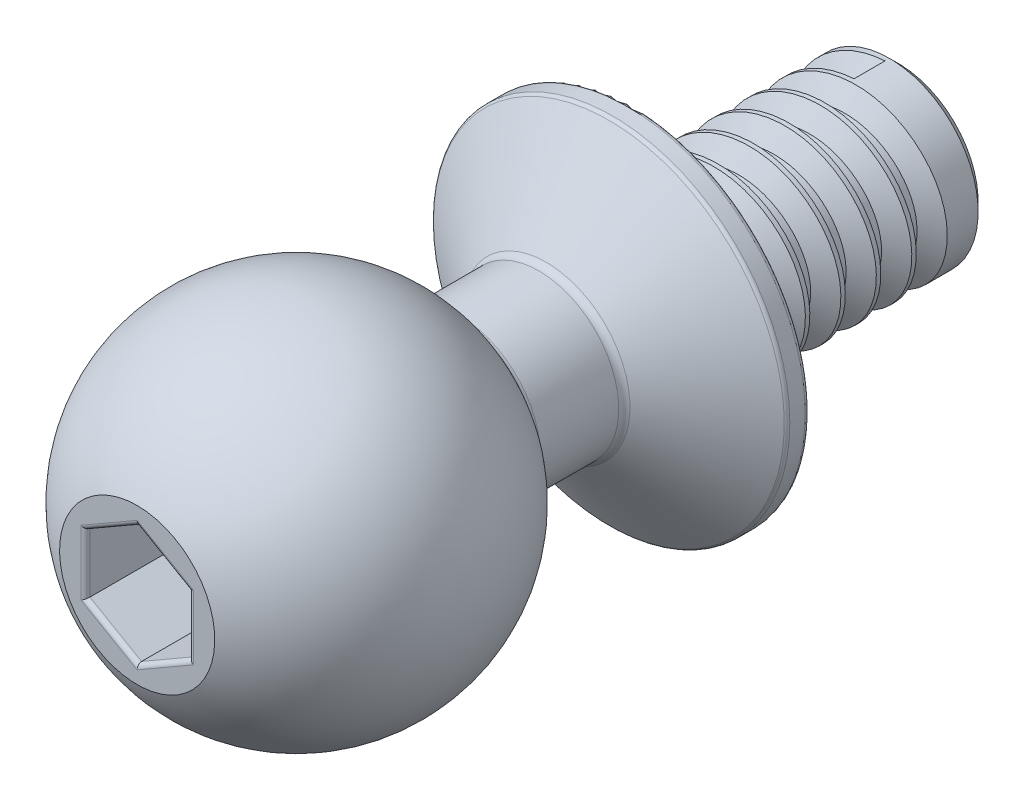
from build123d import *

# Parameters (mm, degrees)
CHAMFER1_SIZE      = 0.1
THREAD1_PITCH      = 0.4
FILLET1_R          = 0.05
FILLET2_R          = 0.1
CUT_EXTRUDE1_DEPTH = 1
FILLET3_R          = 0.05


with BuildPart() as part:
    # Sketch2 → Revolve1 (revolve)
    with BuildSketch(Plane(origin=(0, 0, 0), x_dir=(0, 0, -1), z_dir=(1, 0, 0)), mode=Mode.PRIVATE) as revolve1_sk:
        with BuildLine():
            Line((0, 0), (0, 1))
            Line((0, 1), (-3, 1))
            Line((-3, 1), (-3, 2))
            Line((-3, 2), (-3.25, 2))
            Line((-3.25, 2), (-4, 0.9))
            Line((-4, 0.9), (-5, 0.9))
            ThreePointArc((-5, 0.9), (-6.800005741, 1.999951358), (-8.584493931, 0.875))
            Line((-8.584493931, 0.875), (-8.584493931, 0))
            Line((-8.584493931, 0), (0, 0))
        make_face()
    revolve(revolve1_sk.sketch.rotate(Axis((0, 0, 0), (0, 0, 1)), 90), axis=Axis((0, 0, 0), (0, 0, 1)))

    # Chamfer1
    chamfer1_edges = [part.edges().sort_by_distance(p)[0] for p in [
        (1, 0, 0),
    ]]
    chamfer(chamfer1_edges, length=CHAMFER1_SIZE)

    # Thread1: the profile of Thread Profile1 profile screwed along a right-hand helix of 6.25 turns, 6 arcs to a turn; built about Z, then put on its axis
    thread1_z = Axis((0, 0, 0), (0, 0, 1))
    thread1_corners = [(1.0003, 0, -0.000173205), (1.0003, 0, 0.350173204), (0.78349365, 0, 0.224999999), (0.78349365, 0, 0.124999999)]
    with BuildLine(mode=Mode.PRIVATE) as thread1_profile:
        Line(thread1_corners[0], thread1_corners[1])
        Line(thread1_corners[1], thread1_corners[2])
        Line(thread1_corners[2], thread1_corners[3])
        Line(thread1_corners[3], thread1_corners[0])
    thread1_cap = Face(thread1_profile.wire())
    thread1_turn_angles = [0, 30, 60, 90, 120, 150, 180, 210, 240, 270, 300, 330, 360]
    thread1_turn_weights = [1, 0.8660254037844387, 1, 0.8660254037844387, 1, 0.8660254037844387, 1, 0.8660254037844387, 1, 0.8660254037844387, 1, 0.8660254037844387, 1]
    thread1_turn_rails = [Edge.make_bspline([Vector(p[0], p[1], 0).rotate(thread1_z, thread1_turn_angles[k]) / thread1_turn_weights[k] + Vector(0, 0, p[2] + THREAD1_PITCH * thread1_turn_angles[k] / 360) for k in range(13)], [0, 0, 0, 1, 1, 2, 2, 3, 3, 4, 4, 5, 5, 6, 6, 6], 2, thread1_turn_weights) for p in thread1_corners]
    thread1_turn_sides = [Face.make_surface_from_curves(thread1_turn_rails[p[0]], thread1_turn_rails[p[1]]) for p in [(0, 1), (1, 2), (2, 3), (3, 0)]]
    thread1_last_angles = [2160, 2190, 2220, 2235, 2250]
    thread1_last_weights = [1, 0.8660254037844387, 1, 0.9659258262890683, 1]
    thread1_last_rails = [Edge.make_bspline([Vector(p[0], p[1], 0).rotate(thread1_z, thread1_last_angles[k]) / thread1_last_weights[k] + Vector(0, 0, p[2] + THREAD1_PITCH * thread1_last_angles[k] / 360) for k in range(5)], [0, 0, 0, 1, 1, 2, 2, 2], 2, thread1_last_weights) for p in thread1_corners]
    thread1_last_sides = [Face.make_surface_from_curves(thread1_last_rails[p[0]], thread1_last_rails[p[1]]) for p in [(0, 1), (1, 2), (2, 3), (3, 0)]]
    thread1 = Plane(origin=(0, 0, 3), x_dir=(-1, 0, 0), z_dir=(0, 0, -1)) * Solid(Shell([*[p.moved(Location((0, 0, THREAD1_PITCH * i))) for i in range(6) for p in thread1_turn_sides], *thread1_last_sides, thread1_cap, thread1_cap.rotate(thread1_z, 2250).moved(Location((0, 0, THREAD1_PITCH * 2250 / 360)))]))
    add(thread1, mode=Mode.SUBTRACT)

    # Fillet1
    fillet1_edges = [part.edges().sort_by_distance(p)[0] for p in [
        (2, 0, 3.25),
        (2, 0, 3),
    ]]
    fillet(fillet1_edges, radius=FILLET1_R)

    # Fillet2
    fillet2_edges = [part.edges().sort_by_distance(p)[0] for p in [
        (0.9, 0, 5),
        (0.9, 0, 4),
    ]]
    fillet(fillet2_edges, radius=FILLET2_R)

    # Sketch8 → Cut-Extrude1 (cut)
    with BuildSketch(Plane.XY.offset(8.584493931)):
        Polygon((0.582918981, -0.336548431), (0.582918981, 0.336548431), (0, 0.673096862), (-0.582918981, 0.336548431), (-0.582918981, -0.336548431), (0, -0.673096862), align=None)
    extrude(amount=-CUT_EXTRUDE1_DEPTH, mode=Mode.SUBTRACT)

    # Fillet3
    fillet3_edges = [part.edges().sort_by_distance(p)[0] for p in [
        (0.291459491, -0.504822646, 8.584493931),
        (0.582918981, 0, 8.584493931),
        (0.291459491, 0.504822646, 8.584493931),
        (-0.291459491, 0.504822646, 8.584493931),
        (-0.582918981, 0, 8.584493931),
        (-0.291459491, -0.504822646, 8.584493931),
    ]]
    fillet(fillet3_edges, radius=FILLET3_R)


solid = part.part
